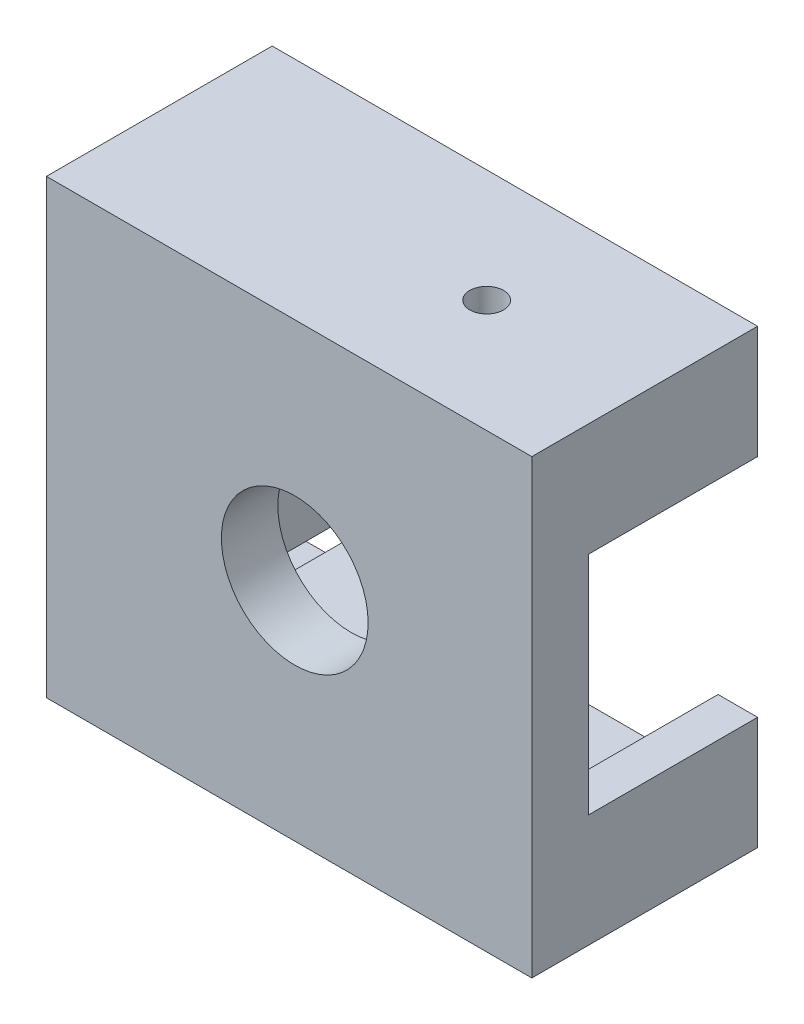
from build123d import *

# Parameters (mm, degrees)
SKETCH1_W           = 43
SKETCH1_H           = 40
BOSS_EXTRUDE1_DEPTH = 5
SKETCH2_W           = 13
SKETCH2_H           = 2
SKETCH2_W_2         = 17.5
SKETCH2_W_3         = 2.5
SKETCH2_H_2         = 10
BOSS_EXTRUDE3_DEPTH = 8
BOSS_EXTRUDE4_DEPTH = 15
SKETCH4_R           = 1.5
CUT_EXTRUDE1_DEPTH  = 65
SKETCH6_R           = 1.5
CUT_EXTRUDE2_DEPTH  = 10
SKETCH7_R           = 6.5
CUT_EXTRUDE3_DEPTH  = 20
SKETCH8_W           = 15
SKETCH8_H           = 20
CUT_EXTRUDE4_DEPTH  = 5


with BuildPart() as part:
    # Sketch1 → Boss-Extrude1 (new body)
    with BuildSketch(Plane.XY):
        with Locations((75.504805995, -8.785410368)):
            Rectangle(SKETCH1_W, SKETCH1_H)
    extrude(amount=BOSS_EXTRUDE1_DEPTH)

    # Sketch2 → Boss-Extrude3 (add)
    with BuildSketch(Plane(origin=(0, 0, 0), x_dir=(-1, 0, 0), z_dir=(0, 0, -1))):
        with Locations((-79.004805995, -0.485410368)):
            Rectangle(SKETCH2_W, SKETCH2_H)
        with Locations((-76.754805995, -16.985410368)):
            Rectangle(SKETCH2_W_2, SKETCH2_H)
        with Locations((-66.754805995, -9.285410368)):
            Rectangle(SKETCH2_W_3, SKETCH2_H_2)
    extrude(amount=BOSS_EXTRUDE3_DEPTH)

    # Sketch3 → Boss-Extrude4 (add)
    with BuildSketch(Plane(origin=(0, 0, 0), x_dir=(-1, 0, 0), z_dir=(0, 0, -1))):
        Polygon((-54.004805995, 11.214589632), (-97.004805995, 11.214589632), (-97.004805995, -28.785410368), (-54.004805995, -28.785410368), (-54.004805995, -25.285410368), (-93.504805995, -25.285410368), (-93.504805995, 7.714589632), (-54.004805995, 7.714589632), align=None)
    extrude(amount=BOSS_EXTRUDE4_DEPTH)

    # Sketch4 → Cut-Extrude1 (cut)
    with BuildSketch(Plane(origin=(0, 11.214589632, 0), x_dir=(1, 0, 0), z_dir=(0, 1, 0))):
        with Locations((83.004805995, 5)):
            Circle(SKETCH4_R)
    extrude(amount=-CUT_EXTRUDE1_DEPTH, mode=Mode.SUBTRACT)

    # Sketch6 → Cut-Extrude2 (cut)
    with BuildSketch(Plane.XZ.offset(28.785410368)):
        with Locations((60.004805995, -5)):
            Circle(SKETCH6_R)
    extrude(amount=-CUT_EXTRUDE2_DEPTH, mode=Mode.SUBTRACT)

    # Sketch7 → Cut-Extrude3 (cut)
    with BuildSketch(Plane.XY.offset(5)):
        with Locations((76.004805995, -8.785410368)):
            Circle(SKETCH7_R)
    extrude(amount=-CUT_EXTRUDE3_DEPTH, mode=Mode.SUBTRACT)

    # Sketch8 → Cut-Extrude4 (cut)
    with BuildSketch(Plane(origin=(97.004805995, 0, 0), x_dir=(0, 0, -1), z_dir=(1, 0, 0))):
        with Locations((7.5, -8.785410368)):
            Rectangle(SKETCH8_W, SKETCH8_H)
    extrude(amount=-CUT_EXTRUDE4_DEPTH, mode=Mode.SUBTRACT)


solid = part.part
